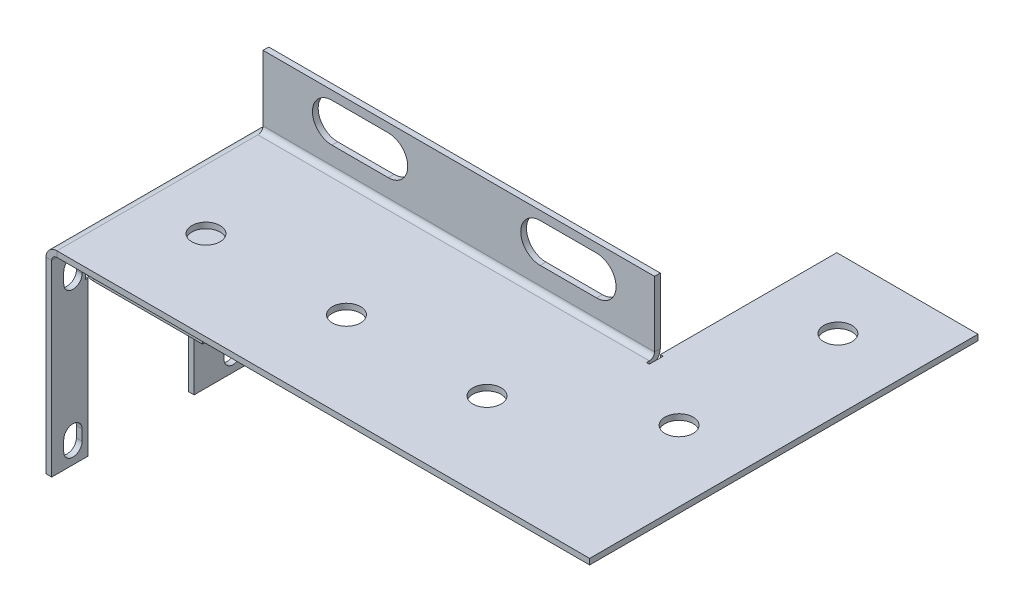
from build123d import *

# Parameters (mm, degrees)
BASE_FLANGE2_DEPTH           = 0.8128
EDGE_FLANGE1_STRIP_W         = 4.7244
EDGE_FLANGE1_STRIP_H         = 0.8128
EDGE_FLANGE1_STRIP_CUT_DEPTH = 30
EDGE_FLANGE1_DEPTH           = 30
EDGE_FLANGE1_FLAT_DEPTH      = 0.8128
EDGE_FLANGE3_START           = 0.7366
EDGE_FLANGE3_DEPTH           = 55.857
EDGE_FLANGE3_START_2         = 56.1872
EDGE_FLANGE3_2_DEPTH         = 0.4064
EDGE_FLANGE3_3_DEPTH         = 55.4506
CUT_EXTRUDE1_REACH           = 92.529
SKETCH21_R                   = 2
CUT_EXTRUDE2_REACH           = 87.061
EDGE_FLANGE4_START           = -5.5664
EDGE_FLANGE4_DEPTH           = 15.8128
EDGE_FLANGE4_2_DEPTH         = 0.4064
EDGE_FLANGE4_START_2         = 9.84
EDGE_FLANGE4_3_DEPTH         = 0.4064
EDGE_FLANGE4_START_3         = -5.16
EDGE_FLANGE4_4_DEPTH         = 15
CUT_EXTRUDE3_REACH           = 90.774
CUT_EXTRUDE4_REACH           = 91.35


# Read off the part's stored shape, not the designer's step: Edge-Flange3, Edge-Flange4
# Sheet-metal steps are written as plain solids
with BuildPart() as part:
    # Sketch7 → Base-Flange2 (new body)
    with BuildSketch(Plane.YZ):
        Polygon((-14.0628, 9.84), (7.7628, 9.84), (7.7628, -5.16), (-14.0628, -5.16), (-14.0628, -15), (14.0628, -15), (14.0628, 15), (-14.0628, 15), align=None)
    extrude(amount=-BASE_FLANGE2_DEPTH)

    # Edge-Flange1 strip (across the edge) → Edge-Flange1 strip cut (cut)
    with BuildSketch(Plane(origin=(0, 14.0628, -15), x_dir=(0, -1, 0), z_dir=(0, 0, 1))):
        with Locations((-0.8128, -0.4064)):
            Rectangle(EDGE_FLANGE1_STRIP_W, EDGE_FLANGE1_STRIP_H)
    extrude(amount=EDGE_FLANGE1_STRIP_CUT_DEPTH, mode=Mode.SUBTRACT)

    # Edge-Flange1 bend section (across the edge) → Edge-Flange1 (add)
    with BuildSketch(Plane(origin=(0, 14.0628, -15), x_dir=(0, -1, 0), z_dir=(0, 0, 1))):
        with BuildLine():
            Line((0, 0.7366), (0.8128, 0.7366))
            ThreePointArc((0.8128, 0.7366), (1.028545145, 0.215745145), (1.5494, 0))
            Line((1.5494, 0), (1.5494, -0.8128))
            ThreePointArc((1.5494, -0.8128), (0.453808753, -0.358991247), (0, 0.7366))
        make_face()
    extrude(amount=EDGE_FLANGE1_DEPTH)

    # Edge-Flange1 profile (on flange) → Edge-Flange1 flat (add)
    with BuildSketch(Plane.ZX.offset(14.0628)):
        Polygon((-40, 56.1872), (-15, 56.1872), (-15, 0.7366), (15, 0.7366), (15, 76.1872), (-40, 76.1872), align=None)
    extrude(amount=-EDGE_FLANGE1_FLAT_DEPTH)

    # Edge-Flange3 outline → Edge-Flange3 (cut)
    with BuildSketch(Plane.YZ.offset(EDGE_FLANGE3_START)):
        with BuildLine():
            Line((14.0628, -15), (14.0628, -14.813707039))
            ThreePointArc((14.0628, -14.813707039), (13.468624211, -14.244121367), (13.25, -13.4506))
            Line((13.25, -13.4506), (13.25, -15))
            Line((13.25, -15), (14.0628, -15))
        make_face()
    extrude(amount=EDGE_FLANGE3_DEPTH, mode=Mode.SUBTRACT)

    # Edge-Flange3 2 outline → Edge-Flange3 2 (cut)
    with BuildSketch(Plane.YZ.offset(EDGE_FLANGE3_START_2)):
        with BuildLine():
            ThreePointArc((13.25, -13.4506), (13.468624211, -14.244121367), (14.0628, -14.813707039))
            Line((14.0628, -14.813707039), (14.0628, -13.0442))
            Line((14.0628, -13.0442), (13.25, -13.0442))
            Line((13.25, -13.0442), (13.25, -13.4506))
        make_face()
    extrude(amount=EDGE_FLANGE3_2_DEPTH, mode=Mode.SUBTRACT)

    # Edge-Flange3 3 outline → Edge-Flange3 3 (add)
    with BuildSketch(Plane.YZ.offset(EDGE_FLANGE3_START)):
        with BuildLine():
            Line((14.7994, -15), (24.0628, -15))
            Line((24.0628, -15), (24.0628, -14.1872))
            Line((24.0628, -14.1872), (14.7994, -14.1872))
            ThreePointArc((14.7994, -14.1872), (14.278545145, -13.971454855), (14.0628, -13.4506))
            Line((14.0628, -13.4506), (14.0628, -14.813707039))
            ThreePointArc((14.0628, -14.813707039), (14.419503755, -14.952704924), (14.7994, -15))
        make_face()
    extrude(amount=EDGE_FLANGE3_3_DEPTH)

    # Sketch21 → Cut-Extrude1 (cut, up to next)
    with BuildSketch(Plane(origin=(0, 14.0628, 0), x_dir=(-1, 0, 0), z_dir=(0, 1, 0)), mode=Mode.PRIVATE) as cut_extrude1_sk1:
        with Locations((-66.1872, -30.16)):
            Circle(SKETCH21_R)
    cut_extrude1_tool1 = extrude(cut_extrude1_sk1.sketch, amount=-CUT_EXTRUDE1_REACH, mode=Mode.PRIVATE) & part.part
    # Sketch21 → Cut-Extrude1 (cut, up to next)
    with BuildSketch(Plane(origin=(0, 14.0628, 0), x_dir=(-1, 0, 0), z_dir=(0, 1, 0)), mode=Mode.PRIVATE) as cut_extrude1_sk2:
        with Locations((-66.1872, -7.66)):
            Circle(SKETCH21_R)
    cut_extrude1_tool2 = extrude(cut_extrude1_sk2.sketch, amount=-CUT_EXTRUDE1_REACH, mode=Mode.PRIVATE) & part.part
    # Sketch21 → Cut-Extrude1 (cut, up to next)
    with BuildSketch(Plane(origin=(0, 14.0628, 0), x_dir=(-1, 0, 0), z_dir=(0, 1, 0)), mode=Mode.PRIVATE) as cut_extrude1_sk3:
        with Locations((-48.982258849, 2.34)):
            Circle(SKETCH21_R)
    cut_extrude1_tool3 = extrude(cut_extrude1_sk3.sketch, amount=-CUT_EXTRUDE1_REACH, mode=Mode.PRIVATE) & part.part
    # Sketch21 → Cut-Extrude1 (cut, up to next)
    with BuildSketch(Plane(origin=(0, 14.0628, 0), x_dir=(-1, 0, 0), z_dir=(0, 1, 0)), mode=Mode.PRIVATE) as cut_extrude1_sk4:
        with Locations((-29.082258849, 2.34)):
            Circle(SKETCH21_R)
    cut_extrude1_tool4 = extrude(cut_extrude1_sk4.sketch, amount=-CUT_EXTRUDE1_REACH, mode=Mode.PRIVATE) & part.part
    # Sketch21 → Cut-Extrude1 (cut, up to next)
    with BuildSketch(Plane(origin=(0, 14.0628, 0), x_dir=(-1, 0, 0), z_dir=(0, 1, 0)), mode=Mode.PRIVATE) as cut_extrude1_sk5:
        with Locations((-9.182258849, 2.34)):
            Circle(SKETCH21_R)
    cut_extrude1_tool5 = extrude(cut_extrude1_sk5.sketch, amount=-CUT_EXTRUDE1_REACH, mode=Mode.PRIVATE) & part.part
    add(cut_extrude1_tool1.solids().sort_by_distance((66.1872, 14.0628, -30.16))[0], mode=Mode.SUBTRACT)
    add(cut_extrude1_tool2.solids().sort_by_distance((66.1872, 14.0628, -7.66))[0], mode=Mode.SUBTRACT)
    add(cut_extrude1_tool3.solids().sort_by_distance((48.982259, 14.0628, 2.34))[0], mode=Mode.SUBTRACT)
    add(cut_extrude1_tool4.solids().sort_by_distance((29.082259, 14.0628, 2.34))[0], mode=Mode.SUBTRACT)
    add(cut_extrude1_tool5.solids().sort_by_distance((9.182259, 14.0628, 2.34))[0], mode=Mode.SUBTRACT)

    # Sketch22 → Cut-Extrude2 (cut, up to next)
    with BuildSketch(Plane.XY.offset(-14.1872), mode=Mode.PRIVATE) as cut_extrude2_sk1:
        with BuildLine():
            Line((10.4866, 22.8128), (18.4866, 22.8128))
            ThreePointArc((18.4866, 22.8128), (21.2366, 20.0628), (18.4866, 17.3128))
            Line((18.4866, 17.3128), (10.4866, 17.3128))
            ThreePointArc((10.4866, 17.3128), (7.7366, 20.0628), (10.4866, 22.8128))
        make_face()
    cut_extrude2_tool1 = extrude(cut_extrude2_sk1.sketch, amount=-CUT_EXTRUDE2_REACH, mode=Mode.PRIVATE) & part.part
    # Sketch22 → Cut-Extrude2 (cut, up to next)
    with BuildSketch(Plane.XY.offset(-14.1872), mode=Mode.PRIVATE) as cut_extrude2_sk2:
        with BuildLine():
            Line((47.9866, 22.8128), (39.9866, 22.8128))
            ThreePointArc((39.9866, 22.8128), (37.2366, 20.0628), (39.9866, 17.3128))
            Line((39.9866, 17.3128), (47.9866, 17.3128))
            ThreePointArc((47.9866, 17.3128), (50.7366, 20.0628), (47.9866, 22.8128))
        make_face()
    cut_extrude2_tool2 = extrude(cut_extrude2_sk2.sketch, amount=-CUT_EXTRUDE2_REACH, mode=Mode.PRIVATE) & part.part
    add(cut_extrude2_tool1.solids().sort_by_distance((14.4866, 20.0628, -14.1872))[0], mode=Mode.SUBTRACT)
    add(cut_extrude2_tool2.solids().sort_by_distance((43.9866, 20.0628, -14.1872))[0], mode=Mode.SUBTRACT)

    # Edge-Flange4 outline → Edge-Flange4 (cut)
    with BuildSketch(Plane.XY.offset(EDGE_FLANGE4_START)):
        with BuildLine():
            ThreePointArc((0, 7.949092961), (-0.594175789, 8.518678633), (-0.8128, 9.3122))
            Line((-0.8128, 9.3122), (-0.8128, 7.7628))
            Line((-0.8128, 7.7628), (0, 7.7628))
            Line((0, 7.7628), (0, 7.949092961))
        make_face()
    extrude(amount=EDGE_FLANGE4_DEPTH, mode=Mode.SUBTRACT)

    # Edge-Flange4 2 outline → Edge-Flange4 2 (cut)
    with BuildSketch(Plane.XY.offset(EDGE_FLANGE4_START)):
        with BuildLine():
            Line((0, 9.7186), (-0.8128, 9.7186))
            Line((-0.8128, 9.7186), (-0.8128, 9.3122))
            ThreePointArc((-0.8128, 9.3122), (-0.594175789, 8.518678633), (0, 7.949092961))
            Line((0, 7.949092961), (0, 9.7186))
        make_face()
    extrude(amount=EDGE_FLANGE4_2_DEPTH, mode=Mode.SUBTRACT)

    # Edge-Flange4 3 outline → Edge-Flange4 3 (cut)
    with BuildSketch(Plane.XY.offset(EDGE_FLANGE4_START_2)):
        with BuildLine():
            Line((0, 9.7186), (-0.8128, 9.7186))
            Line((-0.8128, 9.7186), (-0.8128, 9.3122))
            ThreePointArc((-0.8128, 9.3122), (-0.594175789, 8.518678633), (0, 7.949092961))
            Line((0, 7.949092961), (0, 9.7186))
        make_face()
    extrude(amount=EDGE_FLANGE4_3_DEPTH, mode=Mode.SUBTRACT)

    # Edge-Flange4 4 outline → Edge-Flange4 4 (add)
    with BuildSketch(Plane.XY.offset(EDGE_FLANGE4_START_3)):
        with BuildLine():
            ThreePointArc((0.7366, 8.5756), (0.215745145, 8.791345145), (0, 9.3122))
            Line((0, 9.3122), (0, 7.949092961))
            ThreePointArc((0, 7.949092961), (0.356703755, 7.810095076), (0.7366, 7.7628))
            Line((0.7366, 7.7628), (16.1872, 7.7628))
            Line((16.1872, 7.7628), (16.1872, 8.5756))
            Line((16.1872, 8.5756), (0.7366, 8.5756))
        make_face()
    extrude(amount=EDGE_FLANGE4_4_DEPTH)

    # Sketch27 → Cut-Extrude3 (cut, up to next)
    with BuildSketch(Plane.XZ.offset(-7.7628), mode=Mode.PRIVATE) as cut_extrude3_sk1:
        with BuildLine():
            Line((9.382258849, -1.46), (8.982258849, -1.46))
            ThreePointArc((8.982258849, -1.46), (5.182258849, 2.34), (8.982258849, 6.14))
            Line((8.982258849, 6.14), (9.382258849, 6.14))
            ThreePointArc((9.382258849, 6.14), (13.182258849, 2.34), (9.382258849, -1.46))
        make_face()
    cut_extrude3_tool1 = extrude(cut_extrude3_sk1.sketch, amount=-CUT_EXTRUDE3_REACH, mode=Mode.PRIVATE) & part.part
    add(cut_extrude3_tool1.solids().sort_by_distance((9.182259, 7.7628, 2.34))[0], mode=Mode.SUBTRACT)

    # Sketch33 → Cut-Extrude4 (cut, up to next)
    with BuildSketch(Plane.YZ, mode=Mode.PRIVATE) as cut_extrude4_sk1:
        with BuildLine():
            Line((-11.8128, 13.3), (-10.3128, 13.3))
            ThreePointArc((-10.3128, 13.3), (-9.0128, 12), (-10.3128, 10.7))
            Line((-10.3128, 10.7), (-11.8128, 10.7))
            ThreePointArc((-11.8128, 10.7), (-13.1128, 12), (-11.8128, 13.3))
        make_face()
    cut_extrude4_tool1 = extrude(cut_extrude4_sk1.sketch, amount=-CUT_EXTRUDE4_REACH, mode=Mode.PRIVATE) & part.part
    # Sketch33 → Cut-Extrude4 (cut, up to next)
    with BuildSketch(Plane.YZ, mode=Mode.PRIVATE) as cut_extrude4_sk2:
        with BuildLine():
            Line((8.7634, 10.7), (10.2634, 10.7))
            ThreePointArc((10.2634, 10.7), (11.5634, 12), (10.2634, 13.3))
            Line((10.2634, 13.3), (8.7634, 13.3))
            ThreePointArc((8.7634, 13.3), (7.4634, 12), (8.7634, 10.7))
        make_face()
    cut_extrude4_tool2 = extrude(cut_extrude4_sk2.sketch, amount=-CUT_EXTRUDE4_REACH, mode=Mode.PRIVATE) & part.part
    # Sketch33 → Cut-Extrude4 (cut, up to next)
    with BuildSketch(Plane.YZ, mode=Mode.PRIVATE) as cut_extrude4_sk3:
        with BuildLine():
            Line((8.7634, -12), (10.2634, -12))
            ThreePointArc((10.2634, -12), (11.5634, -10.7), (10.2634, -9.4))
            Line((10.2634, -9.4), (8.7634, -9.4))
            ThreePointArc((8.7634, -9.4), (7.4634, -10.7), (8.7634, -12))
        make_face()
    cut_extrude4_tool3 = extrude(cut_extrude4_sk3.sketch, amount=-CUT_EXTRUDE4_REACH, mode=Mode.PRIVATE) & part.part
    # Sketch33 → Cut-Extrude4 (cut, up to next)
    with BuildSketch(Plane.YZ, mode=Mode.PRIVATE) as cut_extrude4_sk4:
        with BuildLine():
            Line((-11.8128, -12), (-10.3128, -12))
            ThreePointArc((-10.3128, -12), (-9.0128, -10.7), (-10.3128, -9.4))
            Line((-10.3128, -9.4), (-11.8128, -9.4))
            ThreePointArc((-11.8128, -9.4), (-13.1128, -10.7), (-11.8128, -12))
        make_face()
    cut_extrude4_tool4 = extrude(cut_extrude4_sk4.sketch, amount=-CUT_EXTRUDE4_REACH, mode=Mode.PRIVATE) & part.part
    add(cut_extrude4_tool1.solids().sort_by_distance((0, -11.0628, 12))[0], mode=Mode.SUBTRACT)
    add(cut_extrude4_tool2.solids().sort_by_distance((0, 9.5134, 12))[0], mode=Mode.SUBTRACT)
    add(cut_extrude4_tool3.solids().sort_by_distance((0, 9.5134, -10.7))[0], mode=Mode.SUBTRACT)
    add(cut_extrude4_tool4.solids().sort_by_distance((0, -11.0628, -10.7))[0], mode=Mode.SUBTRACT)


solid = part.part
